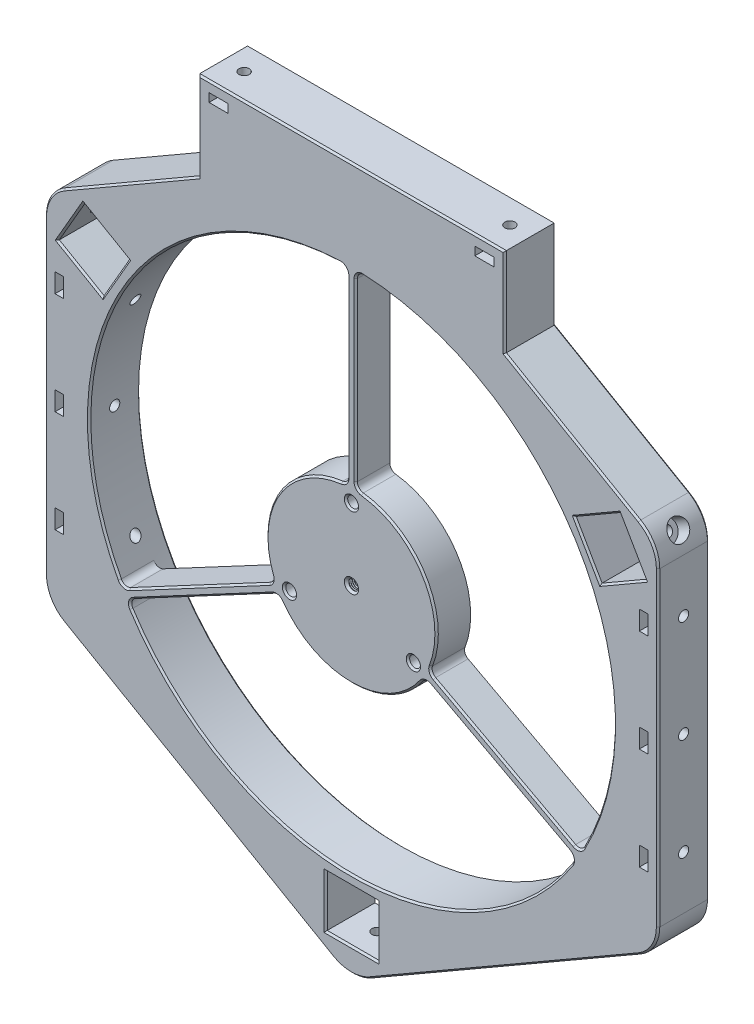
from build123d import *

# Parameters (mm, degrees)
SKETCH1_R           = 77
BOSS_EXTRUDE1_DEPTH = 15
SKETCH2_W           = 15.2
SKETCH2_H           = 15.2
CUT_EXTRUDE1_DEPTH  = 139.293166859
FILLET1_R           = 11.11
SKETCH9_R           = 1.5
CUT_EXTRUDE6_DEPTH  = 3
SKETCH10_R          = 3
CUT_EXTRUDE7_DEPTH  = 232.858348877
CIRPATTERN2_COUNT   = 3
BOSS_EXTRUDE2_START = -10
BOSS_EXTRUDE2_DEPTH = 10
FILLET2_R           = 2
SKETCH19_R          = 1.5
CUT_EXTRUDE14_DEPTH = 30
SKETCH16_R          = 1.55
CUT_EXTRUDE11_DEPTH = 139.293166935
SKETCH30_W          = 5.6
SKETCH30_H          = 2.5
CUT_EXTRUDE16_DEPTH = 139.293166935
SWEEP1_PITCH        = 0.5
SWEEP1_FROM         = 0
SWEEP1_TO           = 10
SKETCH18_R          = 1.6
CUT_EXTRUDE13_DEPTH = 139.293166935
CIRPATTERN3_COUNT   = 3
SKETCH31_R          = 1.5
CUT_EXTRUDE17_DEPTH = 20
SKETCH32_W          = 2.5
SKETCH32_H          = 5.6
CUT_EXTRUDE18_DEPTH = 139.293166935
CHAMFER1_SIZE       = 0.5


with BuildPart() as part:
    # Sketch1 → Boss-Extrude1 (new body)
    with BuildSketch(Plane.XY):
        Polygon((45, 77.942286341), (90, 51.961524227), (90, -51.961524227), (0, -103.923048454), (-90, -51.961524227), (-90, 51.961524227), (-45, 77.942286341), (-45, 103.923048454), (45, 103.923048454), align=None)
        Circle(SKETCH1_R, mode=Mode.SUBTRACT)
    extrude(amount=BOSS_EXTRUDE1_DEPTH)

    # Sketch2 → Cut-Extrude1 (cut, through all)
    with BuildSketch(Plane.XY.offset(15)):
        with Locations((0, -87.6)):
            Rectangle(SKETCH2_W, SKETCH2_H)
        Polygon((-65.482032303, 46.581793069), (-73.082032303, 33.418206931), (-86.24561844, 41.018206931), (-78.64561844, 54.181793069), align=None)
        Polygon((73.082032303, 33.418206931), (65.482032303, 46.581793069), (78.64561844, 54.181793069), (86.24561844, 41.018206931), align=None)
    extrude(amount=-CUT_EXTRUDE1_DEPTH, mode=Mode.SUBTRACT)

    # Fillet1
    fillet1_edges = [part.edges().sort_by_distance(p)[0] for p in [
        (0, -103.923048454, 7.5),
        (-90, -51.961524227, 7.5),
        (-90, 51.961524227, 7.5),
        (90, 51.961524227, 7.5),
        (90, -51.961524227, 7.5),
    ]]
    fillet(fillet1_edges, radius=FILLET1_R)

    # Sketch9 → Cut-Extrude6 (cut)
    with BuildSketch(Plane(origin=(-82.44561844, 47.6, 0), x_dir=(0, 0, -1), z_dir=(0.866025403784436, -0.5000000000000046, 0))):
        with Locations(Location((-7.5, 0, 0), (0, 0, 90))):
            Circle(SKETCH9_R)
    cut_extrude6 = extrude(amount=-CUT_EXTRUDE6_DEPTH, mode=Mode.SUBTRACT)

    # Sketch10 → Cut-Extrude7 (cut, through all)
    with BuildSketch(Plane(origin=(-85.043694652, 49.1, 0), x_dir=(0, 0, -1), z_dir=(0.866025403784436, -0.5000000000000046, 0))):
        with Locations(Location((-7.5, 0, 0), (0, 0, 90))):
            Circle(SKETCH10_R)
    cut_extrude7 = extrude(amount=-CUT_EXTRUDE7_DEPTH, mode=Mode.SUBTRACT)

    # CirPattern2: Cut-Extrude6, Cut-Extrude7 ×3 about axis
    cirpattern2_axis = Axis((0, 0, 0), (0, 0, 1))
    add([cut_extrude6.rotate(cirpattern2_axis, i * 360 / CIRPATTERN2_COUNT) for i in range(1, CIRPATTERN2_COUNT)], mode=Mode.SUBTRACT)
    add([cut_extrude7.rotate(cirpattern2_axis, i * 360 / CIRPATTERN2_COUNT) for i in range(1, CIRPATTERN2_COUNT)], mode=Mode.SUBTRACT)

    # Sketch15 → Boss-Extrude2 (add)
    with BuildSketch(Plane.XY.offset(15).offset(BOSS_EXTRUDE2_START)):
        with BuildLine():
            Line((-1.25, 76.989853228), (-1.25, 21.468730444))
            ThreePointArc((-1.25, 21.468730444), (-21.435577074, 9.365303552), (-22.62235755, -14.140908743))
            Line((-22.62235755, -14.140908743), (-67.066813114, -37.829123419))
            ThreePointArc((-67.066813114, -37.829123419), (-66.443357117, -38.913754574), (-65.802361574, -39.988113375))
            Line((-65.802361574, -39.988113375), (-21.446485834, -16.34711039))
            ThreePointArc((-21.446485834, -16.34711039), (0, -28.5), (21.446485834, -16.34711039))
            Line((21.446485834, -16.34711039), (65.802361574, -39.988113375))
            ThreePointArc((65.802361574, -39.988113375), (66.443357117, -38.913754574), (67.066813114, -37.829123419))
            Line((67.066813114, -37.829123419), (22.62235755, -14.140908743))
            ThreePointArc((22.62235755, -14.140908743), (21.435577074, 9.365303552), (1.25, 21.468730444))
            Line((1.25, 21.468730444), (1.25, 76.989853228))
            ThreePointArc((1.25, 76.989853228), (0, 77), (-1.25, 76.989853228))
        make_face()
    extrude(amount=BOSS_EXTRUDE2_DEPTH)

    # Fillet2
    fillet2_edges = [part.edges().sort_by_distance(p)[0] for p in [
        (-1.25, 76.989853228, 10),
        (1.25, 76.989853228, 10),
        (1.25, 21.468730444, 10),
        (22.62235755, -14.140908743, 10),
        (67.066813114, -37.829123419, 10),
        (65.802361574, -39.988113375, 10),
        (21.446485834, -16.34711039, 10),
        (-21.446485834, -16.34711039, 10),
        (-65.802361574, -39.988113375, 10),
        (-67.066813114, -37.829123419, 10),
        (-22.62235755, -14.140908743, 10),
        (-1.25, 21.468730444, 10),
    ]]
    fillet(fillet2_edges, radius=FILLET2_R)

    # Sketch19 → Cut-Extrude14 (cut)
    with BuildSketch(Plane(origin=(0, 103.923048454, 0), x_dir=(1, 0, 0), z_dir=(0, 1, 0))):
        with Locations(Location((-39, -7.5, 0), (0, 0, 270))):
            Circle(SKETCH19_R)
        with Locations(Location((39, -7.5, 0), (0, 0, 270))):
            Circle(SKETCH19_R)
    extrude(amount=-CUT_EXTRUDE14_DEPTH, mode=Mode.SUBTRACT)

    # Sketch16 → Cut-Extrude11 (cut, through all)
    with BuildSketch(Plane.XY.offset(15)):
        with Locations((0, -3.5)):
            Circle(SKETCH16_R)
    extrude(amount=-CUT_EXTRUDE11_DEPTH, mode=Mode.SUBTRACT)

    # Sketch30 → Cut-Extrude16 (cut, through all)
    with BuildSketch(Plane(origin=(0, 0, 0), x_dir=(-1, 0, 0), z_dir=(0, 0, -1))):
        with Locations((-39, 99.673048454)):
            Rectangle(SKETCH30_W, SKETCH30_H)
        with Locations((39, 99.673048454)):
            Rectangle(SKETCH30_W, SKETCH30_H)
    extrude(amount=-CUT_EXTRUDE16_DEPTH, mode=Mode.SUBTRACT)

    # Sweep1: arcs per turn and ends read off the stored shape
    # Sweep1: the profile of Sketch25 profile screwed along a right-hand helix through 21.666667 turns, 6 arcs to a turn; built about Z, then put on its axis
    sweep1_z = Axis((0, 0, 0), (0, 0, 1))
    sweep1_corners = [(1.5503, 0, -0.500173205), (1.5503, 0, -0.149826795), (1.246891109, 0, -0.325)]
    with BuildLine(mode=Mode.PRIVATE) as sweep1_profile:
        Line(sweep1_corners[0], sweep1_corners[1])
        Line(sweep1_corners[1], sweep1_corners[2])
        Line(sweep1_corners[2], sweep1_corners[0])
    sweep1_cap = Face(sweep1_profile.wire())
    sweep1_turn_angles = [0, 30, 60, 90, 120, 150, 180, 210, 240, 270, 300, 330, 360]
    sweep1_turn_weights = [1, 0.8660254037844387, 1, 0.8660254037844387, 1, 0.8660254037844387, 1, 0.8660254037844387, 1, 0.8660254037844387, 1, 0.8660254037844387, 1]
    sweep1_turn_rails = [Edge.make_bspline([Vector(p[0], p[1], 0).rotate(sweep1_z, sweep1_turn_angles[k]) / sweep1_turn_weights[k] + Vector(0, 0, p[2] + SWEEP1_PITCH * sweep1_turn_angles[k] / 360) for k in range(13)], [0, 0, 0, 1, 1, 2, 2, 3, 3, 4, 4, 5, 5, 6, 6, 6], 2, sweep1_turn_weights) for p in sweep1_corners]
    sweep1_turn_sides = [Face.make_surface_from_curves(sweep1_turn_rails[p[0]], sweep1_turn_rails[p[1]]) for p in [(0, 1), (1, 2), (2, 0)]]
    sweep1_last_angles = [7560, 7590, 7620, 7650, 7680, 7710, 7740, 7770, 7800]
    sweep1_last_weights = [1, 0.8660254037844387, 1, 0.8660254037844387, 1, 0.8660254037844387, 1, 0.8660254037844387, 1]
    sweep1_last_rails = [Edge.make_bspline([Vector(p[0], p[1], 0).rotate(sweep1_z, sweep1_last_angles[k]) / sweep1_last_weights[k] + Vector(0, 0, p[2] + SWEEP1_PITCH * sweep1_last_angles[k] / 360) for k in range(9)], [0, 0, 0, 1, 1, 2, 2, 3, 3, 4, 4, 4], 2, sweep1_last_weights) for p in sweep1_corners]
    sweep1_last_sides = [Face.make_surface_from_curves(sweep1_last_rails[p[0]], sweep1_last_rails[p[1]]) for p in [(0, 1), (1, 2), (2, 0)]]
    sweep1 = Plane(origin=(0, -3.5, 15), x_dir=(0, 1, 0), z_dir=(0, 0, -1)) * split(split(Solid(Shell([*[p.moved(Location((0, 0, SWEEP1_PITCH * i))) for i in range(21) for p in sweep1_turn_sides], *sweep1_last_sides, sweep1_cap, sweep1_cap.rotate(sweep1_z, 7800).moved(Location((0, 0, SWEEP1_PITCH * 7800 / 360)))])), bisect_by=Plane.XY.offset(SWEEP1_FROM), keep=Keep.TOP, mode=Mode.PRIVATE), bisect_by=Plane.XY.offset(SWEEP1_TO), keep=Keep.BOTTOM, mode=Mode.PRIVATE)
    add(sweep1)

    # Sketch29 → Cut-Revolve1 (revolve, cut)
    with BuildSketch(Plane(origin=(0, 0, 0), x_dir=(0, 0, -1), z_dir=(1, 0, 0)), mode=Mode.PRIVATE) as cut_revolve1_sk:
        Polygon((-15, -3.5), (-15, -1.4), (-12.9, -3.5), align=None)
    revolve(cut_revolve1_sk.sketch.rotate(Axis((0, -3.5, 0), (0, 0, 1)), 231.265693466), axis=Axis((0, -3.5, 0), (0, 0, 1)), mode=Mode.SUBTRACT)

    # Sketch18 → Cut-Extrude13 (cut, through all)
    with BuildSketch(Plane.XY.offset(15)):
        with Locations((0, 17.5)):
            Circle(SKETCH18_R)
    cut_extrude13 = extrude(amount=-CUT_EXTRUDE13_DEPTH, mode=Mode.SUBTRACT)

    # CirPattern3: Cut-Extrude13 ×3 about axis
    cirpattern3_axis = Axis((0, -3.5, 0), (0, 0, 1))
    for i in range(1, CIRPATTERN3_COUNT):
        add(cut_extrude13.rotate(cirpattern3_axis, i * 360 / CIRPATTERN3_COUNT), mode=Mode.SUBTRACT)

    # Sketch31 → Cut-Extrude17 (cut)
    with BuildSketch(Plane(origin=(90, 0, 0), x_dir=(0, 0, -1), z_dir=(1, 0, 0))):
        with Locations(Location((-7.5, 30, 0), (0, 0, 90))):
            Circle(SKETCH31_R)
        with Locations(Location((-7.5, -30, 0), (0, 0, 90))):
            Circle(SKETCH31_R)
        with Locations(Location((-7.5, 0, 0), (0, 0, 90))):
            Circle(SKETCH31_R)
    cut_extrude17 = extrude(amount=-CUT_EXTRUDE17_DEPTH, mode=Mode.SUBTRACT)

    # Mirror1: Cut-Extrude17 across plane
    add(cut_extrude17.mirror(Plane(origin=(0, 0, 0), x_dir=(0, 0, 1), z_dir=(1, 0, 0))), mode=Mode.SUBTRACT)

    # Sketch32 → Cut-Extrude18 (cut, through all)
    with BuildSketch(Plane.XY.offset(15)):
        with Locations((-85.75, 30)):
            Rectangle(SKETCH32_W, SKETCH32_H)
        with Locations((-85.75, 0)):
            Rectangle(SKETCH32_W, SKETCH32_H)
        with Locations((-85.75, -30)):
            Rectangle(SKETCH32_W, SKETCH32_H)
        with Locations((85.75, -30)):
            Rectangle(SKETCH32_W, SKETCH32_H)
        with Locations((85.75, 0)):
            Rectangle(SKETCH32_W, SKETCH32_H)
        with Locations((85.75, 30)):
            Rectangle(SKETCH32_W, SKETCH32_H)
    extrude(amount=-CUT_EXTRUDE18_DEPTH, mode=Mode.SUBTRACT)

    # Chamfer1
    chamfer1_edges = [part.edges().sort_by_distance(p)[0] for p in [
        (0, 103.923048454, 0),
        (45, 90.932667397, 0),
        (45, 90.932667397, 15),
        (0, 103.923048454, 15),
        (44.781371735, -25.951324201, 15),
        (21.435577074, 9.365303552, 15),
        (0, -28.5, 15),
        (43.487174436, -28.094460123, 15),
        (-1.25, 49.116617347, 15),
        (-21.435577074, 9.365303552, 15),
        (1.25, 49.116617347, 15),
        (-66.823713005, 38.256912843, 15),
        (0, -77, 15),
        (55.614401612, 53.254467731, 15),
        (-45, 90.932667397, 15),
        (-43.487174436, -28.094460123, 15),
        (-44.781371735, -25.951324201, 15),
        (23.307800004, -13.936153384, 15),
        (21.658673221, -17.030288717, 15),
        (-1.753089602, 21.977313739, 15),
        (1.753089602, 21.977313739, 15),
        (64.903983563, -40.242301662, 15),
        (66.846671706, -37.046271819, 15),
        (-21.658673221, -17.030288717, 15),
        (-23.307800004, -13.936153384, 15),
        (-66.846671706, -37.046271819, 15),
        (-64.903983563, -40.242301662, 15),
        (1.866767072, 76.374080158, 15),
        (-1.866767072, 76.374080158, 15),
        (-64.7225, 66.555495657, 15),
        (-77, 0, 0),
        (41.8, 99.673048454, 0),
        (39, 98.423048454, 0),
        (36.2, 99.673048454, 0),
        (39, 100.923048454, 0),
        (-39, 100.923048454, 0),
        (-36.2, 99.673048454, 0),
        (-39, 98.423048454, 0),
        (-41.8, 99.673048454, 0),
        (-1.6, 17.5, 15),
        (-17.386533479, -15.385640646, 15),
        (18.986533479, -12.614359354, 15),
        (87, 30, 0),
        (84.5, 30, 0),
        (7.6, -87.6, 0),
        (85.75, 32.8, 0),
        (85.75, 27.2, 0),
        (0, -95.2, 0),
        (87, 0, 0),
        (84.5, 0, 0),
        (85.75, 2.8, 0),
        (85.75, -2.8, 0),
        (-7.6, -87.6, 0),
        (0, -80, 0),
        (87, -30, 0),
        (84.5, -30, 0),
        (85.75, -32.8, 0),
        (85.75, -27.2, 0),
        (7.6, -87.6, 15),
        (0, -80, 15),
        (-85.75, -32.8, 0),
        (-87, -30, 0),
        (-85.75, -27.2, 0),
        (-84.5, -30, 0),
        (-7.6, -87.6, 15),
        (0, -95.2, 15),
        (-87, 0, 0),
        (-85.75, 2.8, 0),
        (-84.5, 0, 0),
        (-85.75, -2.8, 0),
        (-87, 30, 0),
        (-85.75, 32.8, 0),
        (-84.5, 30, 0),
        (-85.75, 27.2, 0),
        (-79.663825372, 37.218206931, 0),
        (-82.44561844, 47.6, 0),
        (-72.063825372, 50.381793069, 0),
        (-69.282032303, 40, 0),
        (-79.663825372, 37.218206931, 15),
        (-69.282032303, 40, 15),
        (-72.063825372, 50.381793069, 15),
        (-82.44561844, 47.6, 15),
        (72.063825372, 50.381793069, 0),
        (82.44561844, 47.6, 0),
        (79.663825372, 37.218206931, 0),
        (69.282032303, 40, 0),
        (72.063825372, 50.381793069, 15),
        (69.282032303, 40, 15),
        (79.663825372, 37.218206931, 15),
        (82.44561844, 47.6, 15),
        (-45, -77.942286341, 0),
        (-45, -77.942286341, 15),
        (45, -77.942286341, 0),
        (-90, 0, 0),
        (64.7225, 66.555495657, 0),
        (90, 0, 0),
        (0, -102.204325473, 0),
        (88.511542236, -51.102162736, 0),
        (88.511542236, 51.102162736, 0),
        (-88.511542236, 51.102162736, 0),
        (-88.511542236, -51.102162736, 0),
        (-90, 0, 15),
        (45, -77.942286341, 15),
        (90, 0, 15),
        (64.7225, 66.555495657, 15),
        (0, -102.204325473, 15),
        (88.511542236, -51.102162736, 15),
        (88.511542236, 51.102162736, 15),
        (-88.511542236, 51.102162736, 15),
        (-88.511542236, -51.102162736, 15),
        (-64.7225, 66.555495657, 0),
        (-45, 90.932667397, 0),
    ]]
    chamfer(chamfer1_edges, length=CHAMFER1_SIZE)


solid = part.part
